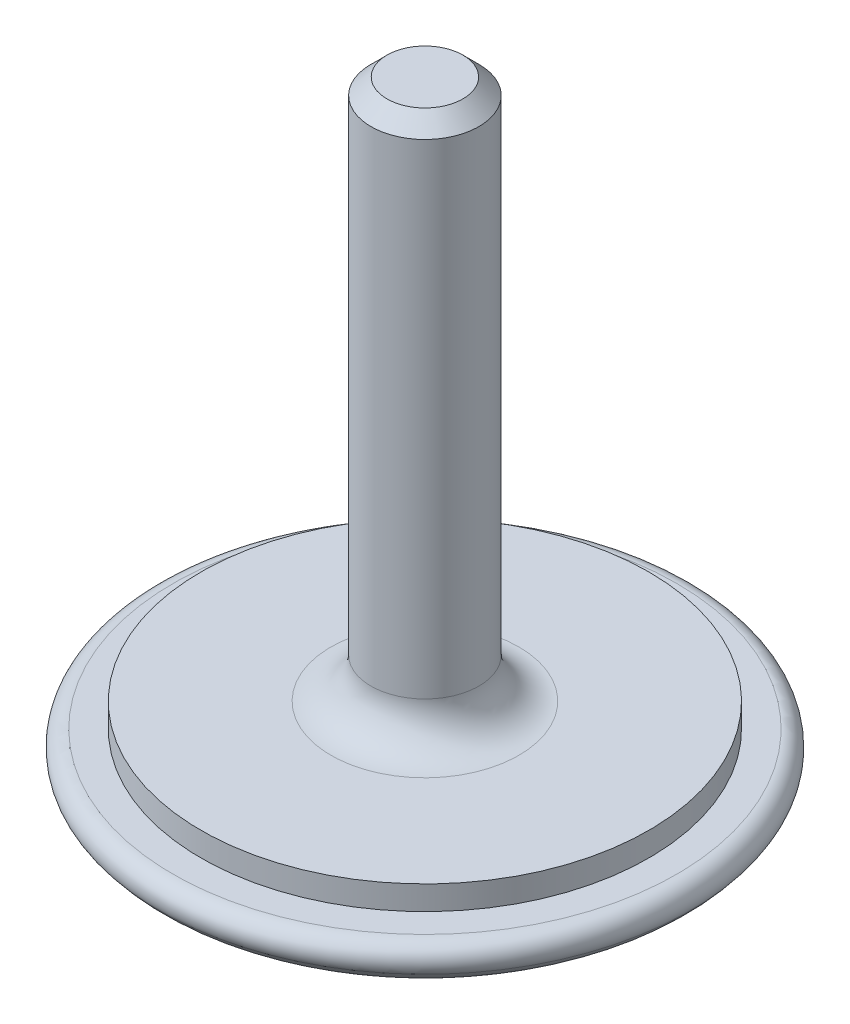
from build123d import *


with BuildPart() as part:
    # Sketch1 → Revolve1 (revolve)
    with BuildSketch(Plane.XY):
        with BuildLine():
            Line((3, 0), (6.110643917, 0))
            ThreePointArc((6.110643917, 0), (7.242676055, 0.064281443), (8.36015446, 0.256299352))
            Line((8.36015446, 0.256299352), (14.800032714, 1.743062396))
            ThreePointArc((14.800032714, 1.743062396), (15.788233421, 2.169324212), (16.562410224, 2.916913705))
            ThreePointArc((16.562410224, 2.916913705), (16.639687107, 3.956570753), (15.75, 4.5))
            Line((15.75, 4.5), (14, 4.5))
            Line((14, 4.5), (14, 6))
            Line((14, 6), (5.875, 6))
            ThreePointArc((5.875, 6), (4.107233047, 6.732233047), (3.375, 8.5))
            Line((3.375, 8.5), (3.375, 38.8))
            Line((3.375, 38.8), (2.375, 39.8))
            Line((2.375, 39.8), (0, 39.8))
            Line((0, 39.8), (0, 1))
            ThreePointArc((0, 1), (1.58113883, 0.74341649), (3, 0))
        make_face()
    revolve(axis=Axis((0, 0, 0), (0, 1, 0)))


solid = part.part
